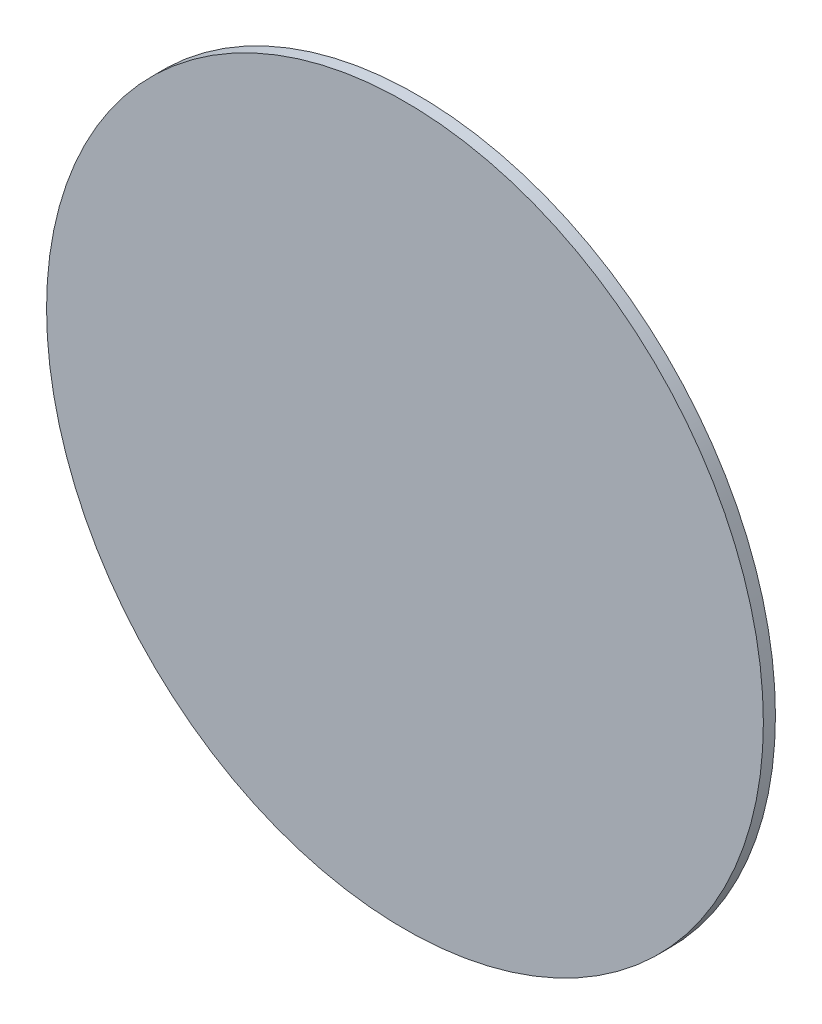
from build123d import *

# Parameters (mm, degrees)
ESQUISSE1_R        = 47.5
BOSS_EXTRU_1_DEPTH = 1.6


with BuildPart() as part:
    # Esquisse1 → Boss.-Extru.1 (new body)
    with BuildSketch(Plane.XY):
        Circle(ESQUISSE1_R)
    extrude(amount=BOSS_EXTRU_1_DEPTH)


solid = part.part
